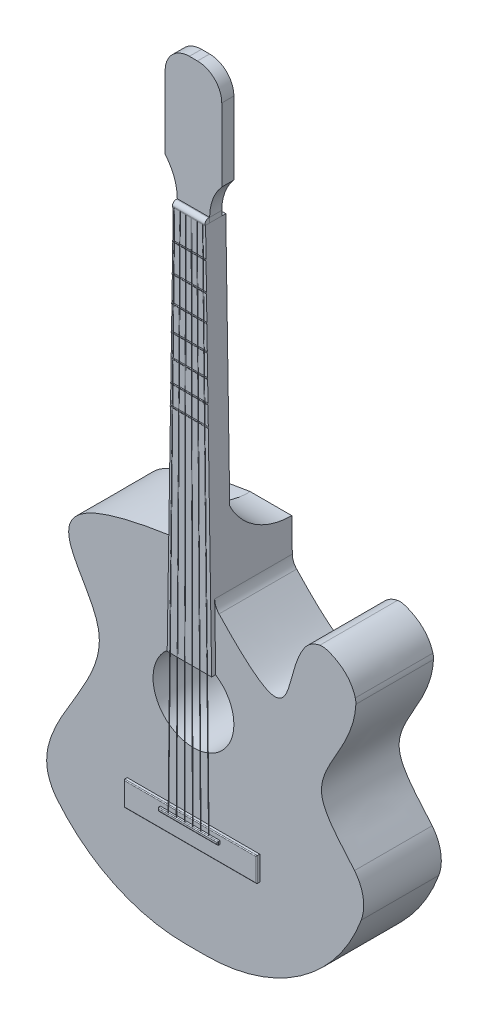
from build123d import *

# Parameters (mm, degrees)
BOSS_EXTRUDE1_DEPTH  = 20
BOSS_EXTRUDE2_DEPTH  = 96
FILLET3_R            = 20
BOSS_EXTRUDE3_DEPTH  = 5
BOSS_EXTRUDE4_DEPTH  = 96
CHAMFER1_SIZE        = 48
CUT_EXTRUDE1_DEPTH   = 55
SKETCH28_R           = 50
CUT_EXTRUDE14_DEPTH  = 80
BOSS_EXTRUDE18_DEPTH = 0.5
FILLET31_R           = 1
SKETCH32_W           = 40
SKETCH32_H           = 6
BOSS_EXTRUDE19_DEPTH = 1
SKETCH33_W           = 40
SKETCH33_H           = 6
BOSS_EXTRUDE20_DEPTH = 5
FILLET32_R           = 5
BOSS_EXTRUDE21_DEPTH = 4
SKETCH35_W           = 74
SKETCH35_H           = 4
BOSS_EXTRUDE22_DEPTH = 3
FILLET33_R           = 1
FILLET34_R           = 1
BOSS_EXTRUDE23_DEPTH = 15
SWEEP9_PROFILE_R     = 0.25
SWEEP14_PROFILE_R    = 0.25
SWEEP15_PROFILE_R    = 0.25
SWEEP16_PROFILE_R    = 0.25
SWEEP17_PROFILE_R    = 0.25
SWEEP18_PROFILE_R    = 0.25


with BuildPart() as part:
    # Sketch1 → Boss-Extrude1 (new body)
    with BuildSketch(Plane.XY):
        Polygon((40, 0), (0, 0), (-7.5, -480), (0, -480), (20, -480), (40, -480), (47.5, -480), align=None)
    extrude(amount=-BOSS_EXTRUDE1_DEPTH)

    # Sketch2 → Boss-Extrude2 (add)
    with BuildSketch(Plane.XY):
        with BuildLine():
            Line((10.219610861, -786.968604214), (35.14770821, -786.968604214))
            ThreePointArc((35.14770821, -786.968604214), (152.317235778, -750.183650537), (227.437244868, -653.030085282))
            ThreePointArc((227.437244868, -653.030085282), (229.845672292, -627.410065854), (219.193591135, -603.98531217))
            add(Edge.make_bspline(
                [(219.193591135, -603.98531217), (202.390568913, -583.503251259), (147.151942297, -529.611408553), (218.152428529, -476.200616028), (220.851380358, -425.0648756)],
                knots=[0.199231014, 0.199231014, 0.199231014, 0.199231014, 0.323150604, 0.537684641, 0.537684641, 0.537684641, 0.537684641], degree=3))
            ThreePointArc((220.851380358, -425.0648756), (220.757173483, -421.804982868), (220.134421907, -418.603739978))
            add(Edge.make_bspline(
                [(176.366999248, -383.995427543), (180.66359913, -383.177159069), (200.057343412, -388.929095367), (215.470049543, -401.99312039), (220.134421907, -418.603739978)],
                knots=[0.180916706, 0.180916706, 0.180916706, 0.180916706, 0.355528149, 0.960011037, 0.960011037, 0.960011037, 0.960011037], degree=3))
            ThreePointArc((176.366999248, -383.995427543), (165.712415207, -388.258961345), (157.438208459, -396.211029268))
            add(Edge.make_bspline(
                [(157.438208459, -396.211029268), (126.925707927, -439.608771107), (154.816116558, -524.862903433), (46.362546103, -407.202950609)],
                knots=[0.793265859, 0.793265859, 0.793265859, 0.793265859, 1, 1, 1, 1], degree=3))
            Line((46.362546103, -407.202950609), (45.60131722, -358.484302107))
            Line((45.60131722, -358.484302107), (-5.264752066, -358.484302107))
            add(Edge.make_bspline(
                [(-5.264752066, -358.484302107), (-217.82456269, -389.343935587), (15.057561493, -504.241037009), (-198.228031957, -649.372190009), (-148.717501724, -711.44444846)],
                knots=[0, 0, 0, 0, 0.481381152, 1, 1, 1, 1], degree=3))
            ThreePointArc((-148.717501724, -711.44444846), (-77.764626164, -767.127384819), (10.219610861, -786.968604214))
        make_face()
    extrude(amount=-BOSS_EXTRUDE2_DEPTH)

    # Fillet3
    fillet3_edges = [part.edges().sort_by_distance(p)[0] for p in [
        (46.362546103, -407.202950609, -48),
    ]]
    fillet(fillet3_edges, radius=FILLET3_R)

    # Sketch4 → Boss-Extrude3 (add)
    with BuildSketch(Plane.XY):
        Polygon((-7.5, -480), (0, 0), (40, 0), (47.5, -480), align=None)
    extrude(amount=BOSS_EXTRUDE3_DEPTH)

    # Sketch5 → Boss-Extrude4 (add)
    with BuildSketch(Plane.XY):
        Polygon((45.60131722, -358.484302107), (-5.264752066, -358.484302107), (-5.602083381, -358.533336367), (-4.853669592, -310.634853862), (44.853669592, -310.634853862), align=None)
    extrude(amount=-BOSS_EXTRUDE4_DEPTH)

    # Chamfer1
    # the kernel refuses this chamfer: 48 mm, written as the material it takes off along each edge
    with BuildSketch(Plane(origin=(-128.294453014, -310.634853862, -96), x_dir=(0, -0.9996219169112968, -0.02749587661058648), z_dir=(1, 0, 0))) as chamfer1_piece_1:
        Polygon((CHAMFER1_SIZE * 0.999621916911, -CHAMFER1_SIZE * 0.0274958766106), (-CHAMFER1_SIZE * 0.0274958766106, -CHAMFER1_SIZE * 0.999621916911), (0, 0), align=None)
    extrude(amount=296.588906028, mode=Mode.SUBTRACT)

    # Sketch7 → Cut-Extrude1 (cut, symmetric)
    with BuildSketch(Plane(origin=(0, 0, 0), x_dir=(0, 0, -1), z_dir=(1, 0, 0))):
        with BuildLine():
            ThreePointArc((96, -358.634853862), (51.055589892, -345.630169867), (20, -310.634853862))
            Line((20, -310.634853862), (96, -310.634853862))
            Line((96, -310.634853862), (96, -358.634853862))
        make_face()
    extrude(amount=CUT_EXTRUDE1_DEPTH, both=True, mode=Mode.SUBTRACT)

    # Sketch28 → Cut-Extrude14 (cut)
    with BuildSketch(Plane.XY):
        with Locations((20, -522)):
            Circle(SKETCH28_R)
    extrude(amount=-CUT_EXTRUDE14_DEPTH, mode=Mode.SUBTRACT)

    # Sketch30 → Boss-Extrude18 (add)
    with BuildSketch(Plane.XY.offset(5)):
        Polygon((0, -162), (-2.53125, -162), (-2.5625, -164), (0, -164), (40.59375, -164), (42.5625, -164), (42.53125, -162), (40.59375, -162), align=None)
        Polygon((39.752435227, -36), (40.5625, -36), (40.59375, -38), (39.752435227, -38), (0, -38), (-0.59375, -38), (-0.5625, -36), (0, -36), align=None)
        Polygon((0, -71), (-1.109375, -71), (-1.140625, -73), (0, -73), (39.752435227, -73), (41.140625, -73), (41.109375, -71), (39.752435227, -71), align=None)
        Polygon((39.752435227, -103), (41.609375, -103), (41.640625, -105), (39.752435227, -105), (0, -105), (-1.640625, -105), (-1.609375, -103), (0, -103), align=None)
        Polygon((0, -134), (-2.09375, -134), (-2.125, -136), (0, -136), (40.59375, -136), (42.125, -136), (42.09375, -134), (40.59375, -134), align=None)
        Polygon((0, -189), (-2.953125, -189), (-2.984375, -191), (0, -191), (39.752435227, -191), (42.984375, -191), (42.953125, -189), (39.752435227, -189), align=None)
        Polygon((0, -214), (-3.34375, -214), (-3.375, -216), (0, -216), (40.59375, -216), (43.375, -216), (43.34375, -214), (40.59375, -214), align=None)
    extrude(amount=BOSS_EXTRUDE18_DEPTH)

    # Fillet31
    # the kernel refuses this fillet: 1 mm, written as the material it takes off along each edge
    with BuildSketch(Plane(origin=(45.540063509, -216, 5.5), x_dir=(0, 0, -1), z_dir=(-1, 0, 0))) as fillet31_piece_1:
        with BuildLine():
            CenterArc((1, -0.866025404), FILLET31_R, 120, 60)
            Line((0, -0.866025404), (-0.02, -0.866025404))
            Line((-0.02, -0.866025404), (-0.02, 0))
            Line((-0.02, 0), (0, 0.02))
            ThreePointArc((0, 0.02), (0.25, 0.02), (0.49, 0.017320508))
            Line((0.49, 0.017320508), (0.5, 0))
        make_face()
    extrude(amount=51.080127019, mode=Mode.SUBTRACT)
    with BuildSketch(Plane(origin=(-5.508813509, -214, 5.5), x_dir=(0, 0, -1), z_dir=(1, 0, 0))) as fillet31_piece_2:
        with BuildLine():
            CenterArc((1, -0.866025404), FILLET31_R, 120, 60)
            Line((0, -0.866025404), (-0.02, -0.866025404))
            Line((-0.02, -0.866025404), (-0.02, 0))
            Line((-0.02, 0), (0, 0.02))
            ThreePointArc((0, 0.02), (0.25, 0.02), (0.49, 0.017320508))
            Line((0.49, 0.017320508), (0.5, 0))
        make_face()
    extrude(amount=51.017627019, mode=Mode.SUBTRACT)
    with BuildSketch(Plane(origin=(45.149438509, -191, 5.5), x_dir=(0, 0, -1), z_dir=(-1, 0, 0))) as fillet31_piece_3:
        with BuildLine():
            CenterArc((1, -0.866025404), FILLET31_R, 120, 60)
            Line((0, -0.866025404), (-0.02, -0.866025404))
            Line((-0.02, -0.866025404), (-0.02, 0))
            Line((-0.02, 0), (0, 0.02))
            ThreePointArc((0, 0.02), (0.25, 0.02), (0.49, 0.017320508))
            Line((0.49, 0.017320508), (0.5, 0))
        make_face()
    extrude(amount=50.298877019, mode=Mode.SUBTRACT)
    with BuildSketch(Plane(origin=(-5.118188509, -189, 5.5), x_dir=(0, 0, -1), z_dir=(1, 0, 0))) as fillet31_piece_4:
        with BuildLine():
            CenterArc((1, -0.866025404), FILLET31_R, 120, 60)
            Line((0, -0.866025404), (-0.02, -0.866025404))
            Line((-0.02, -0.866025404), (-0.02, 0))
            Line((-0.02, 0), (0, 0.02))
            ThreePointArc((0, 0.02), (0.25, 0.02), (0.49, 0.017320508))
            Line((0.49, 0.017320508), (0.5, 0))
        make_face()
    extrude(amount=50.236377019, mode=Mode.SUBTRACT)
    with BuildSketch(Plane(origin=(44.727563509, -164, 5.5), x_dir=(0, 0, -1), z_dir=(-1, 0, 0))) as fillet31_piece_5:
        with BuildLine():
            CenterArc((1, -0.866025404), FILLET31_R, 120, 60)
            Line((0, -0.866025404), (-0.02, -0.866025404))
            Line((-0.02, -0.866025404), (-0.02, 0))
            Line((-0.02, 0), (0, 0.02))
            ThreePointArc((0, 0.02), (0.25, 0.02), (0.49, 0.017320508))
            Line((0.49, 0.017320508), (0.5, 0))
        make_face()
    extrude(amount=49.455127019, mode=Mode.SUBTRACT)
    with BuildSketch(Plane(origin=(-4.696313509, -162, 5.5), x_dir=(0, 0, -1), z_dir=(1, 0, 0))) as fillet31_piece_6:
        with BuildLine():
            CenterArc((1, -0.866025404), FILLET31_R, 120, 60)
            Line((0, -0.866025404), (-0.02, -0.866025404))
            Line((-0.02, -0.866025404), (-0.02, 0))
            Line((-0.02, 0), (0, 0.02))
            ThreePointArc((0, 0.02), (0.25, 0.02), (0.49, 0.017320508))
            Line((0.49, 0.017320508), (0.5, 0))
        make_face()
    extrude(amount=49.392627019, mode=Mode.SUBTRACT)
    with BuildSketch(Plane(origin=(44.290063509, -136, 5.5), x_dir=(0, 0, -1), z_dir=(-1, 0, 0))) as fillet31_piece_7:
        with BuildLine():
            CenterArc((1, -0.866025404), FILLET31_R, 120, 60)
            Line((0, -0.866025404), (-0.02, -0.866025404))
            Line((-0.02, -0.866025404), (-0.02, 0))
            Line((-0.02, 0), (0, 0.02))
            ThreePointArc((0, 0.02), (0.25, 0.02), (0.49, 0.017320508))
            Line((0.49, 0.017320508), (0.5, 0))
        make_face()
    extrude(amount=48.580127019, mode=Mode.SUBTRACT)
    with BuildSketch(Plane(origin=(-4.258813509, -134, 5.5), x_dir=(0, 0, -1), z_dir=(1, 0, 0))) as fillet31_piece_8:
        with BuildLine():
            CenterArc((1, -0.866025404), FILLET31_R, 120, 60)
            Line((0, -0.866025404), (-0.02, -0.866025404))
            Line((-0.02, -0.866025404), (-0.02, 0))
            Line((-0.02, 0), (0, 0.02))
            ThreePointArc((0, 0.02), (0.25, 0.02), (0.49, 0.017320508))
            Line((0.49, 0.017320508), (0.5, 0))
        make_face()
    extrude(amount=48.517627019, mode=Mode.SUBTRACT)
    with BuildSketch(Plane(origin=(43.805688509, -105, 5.5), x_dir=(0, 0, -1), z_dir=(-1, 0, 0))) as fillet31_piece_9:
        with BuildLine():
            CenterArc((1, -0.866025404), FILLET31_R, 120, 60)
            Line((0, -0.866025404), (-0.02, -0.866025404))
            Line((-0.02, -0.866025404), (-0.02, 0))
            Line((-0.02, 0), (0, 0.02))
            ThreePointArc((0, 0.02), (0.25, 0.02), (0.49, 0.017320508))
            Line((0.49, 0.017320508), (0.5, 0))
        make_face()
    extrude(amount=47.611377019, mode=Mode.SUBTRACT)
    with BuildSketch(Plane(origin=(-3.774438509, -103, 5.5), x_dir=(0, 0, -1), z_dir=(1, 0, 0))) as fillet31_piece_10:
        with BuildLine():
            CenterArc((1, -0.866025404), FILLET31_R, 120, 60)
            Line((0, -0.866025404), (-0.02, -0.866025404))
            Line((-0.02, -0.866025404), (-0.02, 0))
            Line((-0.02, 0), (0, 0.02))
            ThreePointArc((0, 0.02), (0.25, 0.02), (0.49, 0.017320508))
            Line((0.49, 0.017320508), (0.5, 0))
        make_face()
    extrude(amount=47.548877019, mode=Mode.SUBTRACT)
    with BuildSketch(Plane(origin=(43.305688509, -73, 5.5), x_dir=(0, 0, -1), z_dir=(-1, 0, 0))) as fillet31_piece_11:
        with BuildLine():
            CenterArc((1, -0.866025404), FILLET31_R, 120, 60)
            Line((0, -0.866025404), (-0.02, -0.866025404))
            Line((-0.02, -0.866025404), (-0.02, 0))
            Line((-0.02, 0), (0, 0.02))
            ThreePointArc((0, 0.02), (0.25, 0.02), (0.49, 0.017320508))
            Line((0.49, 0.017320508), (0.5, 0))
        make_face()
    extrude(amount=46.611377019, mode=Mode.SUBTRACT)
    with BuildSketch(Plane(origin=(-3.274438509, -71, 5.5), x_dir=(0, 0, -1), z_dir=(1, 0, 0))) as fillet31_piece_12:
        with BuildLine():
            CenterArc((1, -0.866025404), FILLET31_R, 120, 60)
            Line((0, -0.866025404), (-0.02, -0.866025404))
            Line((-0.02, -0.866025404), (-0.02, 0))
            Line((-0.02, 0), (0, 0.02))
            ThreePointArc((0, 0.02), (0.25, 0.02), (0.49, 0.017320508))
            Line((0.49, 0.017320508), (0.5, 0))
        make_face()
    extrude(amount=46.548877019, mode=Mode.SUBTRACT)
    with BuildSketch(Plane(origin=(42.758813509, -38, 5.5), x_dir=(0, 0, -1), z_dir=(-1, 0, 0))) as fillet31_piece_13:
        with BuildLine():
            CenterArc((1, -0.866025404), FILLET31_R, 120, 60)
            Line((0, -0.866025404), (-0.02, -0.866025404))
            Line((-0.02, -0.866025404), (-0.02, 0))
            Line((-0.02, 0), (0, 0.02))
            ThreePointArc((0, 0.02), (0.25, 0.02), (0.49, 0.017320508))
            Line((0.49, 0.017320508), (0.5, 0))
        make_face()
    extrude(amount=45.517627019, mode=Mode.SUBTRACT)
    with BuildSketch(Plane(origin=(-2.727563509, -36, 5.5), x_dir=(0, 0, -1), z_dir=(1, 0, 0))) as fillet31_piece_14:
        with BuildLine():
            CenterArc((1, -0.866025404), FILLET31_R, 120, 60)
            Line((0, -0.866025404), (-0.02, -0.866025404))
            Line((-0.02, -0.866025404), (-0.02, 0))
            Line((-0.02, 0), (0, 0.02))
            ThreePointArc((0, 0.02), (0.25, 0.02), (0.49, 0.017320508))
            Line((0.49, 0.017320508), (0.5, 0))
        make_face()
    extrude(amount=45.455127019, mode=Mode.SUBTRACT)



with BuildPart() as body_2:
    # Sketch32 → Boss-Extrude19 (new body)
    with BuildSketch(Plane.XY.offset(5)):
        with Locations((20, 3)):
            Rectangle(SKETCH32_W, SKETCH32_H)
    extrude(amount=BOSS_EXTRUDE19_DEPTH)


with BuildPart() as part_1:
    add(part.part)

    add(body_2.part)  # Boss-Extrude20 merges body 2
    # Sketch33 → Boss-Extrude20 (add)
    with BuildSketch(Plane(origin=(0, 0, 5), x_dir=(-1, 0, 0), z_dir=(0, 0, -1))):
        with Locations((-20, 3)):
            Rectangle(SKETCH33_W, SKETCH33_H)
    extrude(amount=BOSS_EXTRUDE20_DEPTH)

    # Fillet32
    fillet32_edges = [part_1.edges().sort_by_distance(p)[0] for p in [
        (20, 6, 6),
    ]]
    fillet(fillet32_edges, radius=FILLET32_R)

    # Sketch34 → Boss-Extrude21 (add)
    with BuildSketch(Plane.XY):
        Polygon((102, -645), (20, -645), (-17, -645), (-62, -645), (-62, -675), (102, -675), align=None)
        Polygon((-17, -651), (20, -651), (57, -651), (57, -655), (-17, -655), align=None, mode=Mode.SUBTRACT)
    extrude(amount=BOSS_EXTRUDE21_DEPTH)

    # Fillet33
    fillet33_edges = [part_1.edges().sort_by_distance(p)[0] for p in [
        (20, -645, 4),
        (20, -675, 4),
        (102, -660, 4),
        (-62, -660, 4),
    ]]
    fillet(fillet33_edges, radius=FILLET33_R)


with BuildPart() as body_2_2:
    # Sketch35 → Boss-Extrude22 (new body)
    with BuildSketch(Plane.XY.offset(4)):
        with Locations((20, -653)):
            Rectangle(SKETCH35_W, SKETCH35_H)
    extrude(amount=BOSS_EXTRUDE22_DEPTH)

    # Fillet34
    fillet34_edges = [body_2_2.edges().sort_by_distance(p)[0] for p in [
        (57, -653, 7),
        (20, -651, 7),
        (-17, -653, 7),
        (20, -655, 7),
    ]]
    fillet(fillet34_edges, radius=FILLET34_R)


with BuildPart() as body_3:
    # Sketch44 → Boss-Extrude23 (new body)
    with BuildSketch(Plane(origin=(0, 0, 0), x_dir=(-1, 0, 0), z_dir=(0, 0, -1))):
        with BuildLine():
            Line((-40, 0), (0, 0))
            Line((0, 0), (0, 6))
            ThreePointArc((0, 6), (3.873308365, 27.360009363), (15, 46))
            Line((15, 46), (15, 136))
            ThreePointArc((15, 136), (6.213203436, 157.213203436), (-15, 166))
            Line((-15, 166), (-25, 166))
            ThreePointArc((-25, 166), (-46.213203436, 157.213203436), (-55, 136))
            Line((-55, 136), (-55, 46))
            ThreePointArc((-55, 46), (-43.873308365, 27.360009363), (-40, 6))
            Line((-40, 6), (-40, 0))
        make_face()
    extrude(amount=BOSS_EXTRUDE23_DEPTH)


with BuildPart() as body_4:
    # Sweep9: sweep along a path in Sketch46
    with BuildLine(Plane(origin=(0, 0, 6), x_dir=(-1, 0, 0), z_dir=(0, 0, -1))) as sweep9_path:
        Line((5, -653), (-2.5, 0))
    # Sweep9 profile (on start of the path) → Sweep9 (sweep)
    with BuildSketch(Plane(origin=(-5, -653, 6), x_dir=(0.9999340487238518, -0.011484694280901693, 0), z_dir=(0.011484694280901693, 0.9999340487238518, 0))):
        Circle(SWEEP9_PROFILE_R)
    sweep(path=sweep9_path.line)


with BuildPart() as body_5:
    # Sweep14: sweep along a path in Sketch110
    with BuildLine(Plane(origin=(0, 0, 6), x_dir=(-1, 0, 0), z_dir=(0, 0, -1))) as sweep14_path:
        Line((-5, -653), (-9.5, 0))
    # Sweep14 profile (on start of the path) → Sweep14 (sweep)
    with BuildSketch(Plane(origin=(5, -653, 6), x_dir=(0.9999762560373022, -0.006891107430578526, 0), z_dir=(0.006891107430578526, 0.9999762560373022, 0))):
        Circle(SWEEP14_PROFILE_R)
    sweep(path=sweep14_path.line)


with BuildPart() as body_6:
    # Sweep15: sweep along a path in Sketch125
    with BuildLine(Plane(origin=(0, 0, 6), x_dir=(-1, 0, 0), z_dir=(0, 0, -1))) as sweep15_path:
        Line((-15, -653), (-16.5, 0))
    # Sweep15 profile (on start of the path) → Sweep15 (sweep)
    with BuildSketch(Plane(origin=(15, -653, 6), x_dir=(0.9999973616983979, -0.0022970842918032365, 0), z_dir=(0.0022970842918032365, 0.9999973616983979, 0))):
        Circle(SWEEP15_PROFILE_R)
    sweep(path=sweep15_path.line)


with BuildPart() as body_7:
    # Sweep16: sweep along a path in Sketch132
    with BuildLine(Plane(origin=(0, 0, 6), x_dir=(-1, 0, 0), z_dir=(0, 0, -1))) as sweep16_path:
        Line((-25, -653), (-23.5, 0))
    # Sweep16 profile (on start of the path) → Sweep16 (sweep)
    with BuildSketch(Plane(origin=(25, -653, 6), x_dir=(0.9999973616983979, 0.002297084291803495, 0), z_dir=(-0.002297084291803495, 0.9999973616983979, 0))):
        Circle(SWEEP16_PROFILE_R)
    sweep(path=sweep16_path.line)


with BuildPart() as body_8:
    # Sweep17: sweep along a path in Sketch139
    with BuildLine(Plane(origin=(0, 0, 6), x_dir=(-1, 0, 0), z_dir=(0, 0, -1))) as sweep17_path:
        Line((-35, -653), (-30.5, 0))
    # Sweep17 profile (on start of the path) → Sweep17 (sweep)
    with BuildSketch(Plane(origin=(35, -653, 6), x_dir=(0.9999762560373022, 0.006891107430578783, 0), z_dir=(-0.006891107430578783, 0.9999762560373022, 0))):
        Circle(SWEEP17_PROFILE_R)
    sweep(path=sweep17_path.line)


with BuildPart() as body_9:
    # Sweep18: sweep along a path in Sketch146
    with BuildLine(Plane(origin=(0, 0, 6), x_dir=(-1, 0, 0), z_dir=(0, 0, -1))) as sweep18_path:
        Line((-45, -653), (-37.5, 0))
    # Sweep18 profile (on start of the path) → Sweep18 (sweep)
    with BuildSketch(Plane(origin=(45, -653, 6), x_dir=(0.9999340487238518, 0.011484694280901951, 0), z_dir=(-0.011484694280901951, 0.9999340487238518, 0))):
        Circle(SWEEP18_PROFILE_R)
    sweep(path=sweep18_path.line)


solid = Compound([part_1.part, body_2_2.part, body_3.part, body_4.part, body_5.part, body_6.part, body_7.part, body_8.part, body_9.part])
